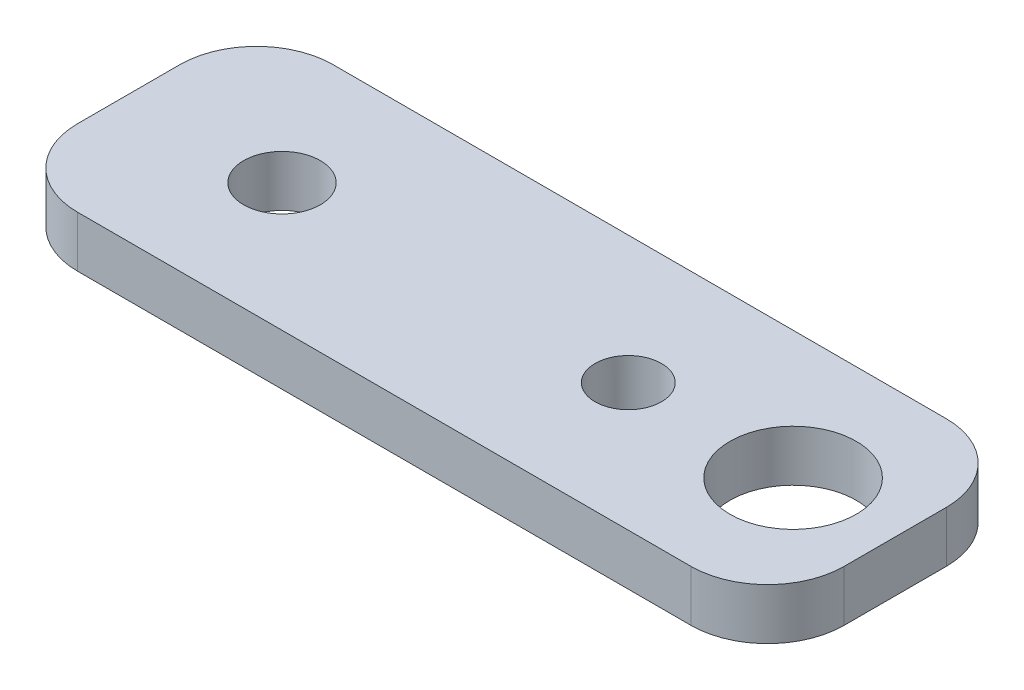
from build123d import *

# Parameters (mm, degrees)
SKETCH1_W                = 30
SKETCH1_H                = 10
BOSS_EXTRUDE1_DEPTH      = 2
SKETCH2_R                = 2.472864358
SKETCH2_R_2              = 1.3
CUT_EXTRUDE1_DEPTH       = 3
FILLET1_R                = 3
F_3_0_3_DIAMETER_HOLE1_D = 3


with BuildPart() as part:
    # Sketch1 → Boss-Extrude1 (new body)
    with BuildSketch(Plane(origin=(0, 0, 0), x_dir=(1, 0, 0), z_dir=(0, 1, 0))):
        Rectangle(SKETCH1_W, SKETCH1_H)
    extrude(amount=BOSS_EXTRUDE1_DEPTH)

    # Sketch2 → Cut-Extrude1 (cut)
    with BuildSketch(Plane(origin=(0, 2, 0), x_dir=(1, 0, 0), z_dir=(0, 1, 0))):
        with Locations((11, 0)):
            Circle(SKETCH2_R)
        with Locations((4.55, 0)):
            Circle(SKETCH2_R_2)
    extrude(amount=-CUT_EXTRUDE1_DEPTH, mode=Mode.SUBTRACT)

    # Fillet1
    fillet1_edges = [part.edges().sort_by_distance(p)[0] for p in [
        (15, 1, 5),
        (15, 1, -5),
        (-15, 1, -5),
        (-15, 1, 5),
    ]]
    fillet(fillet1_edges, radius=FILLET1_R)

    # Ø3.0 (3) Diameter Hole1 (through all)
    with Locations(Plane(origin=(0, 2, 0), x_dir=(1, 0, 0), z_dir=(0, 1, 0))):
        with Locations((-9, 0)):
            Hole(F_3_0_3_DIAMETER_HOLE1_D / 2)


solid = part.part
